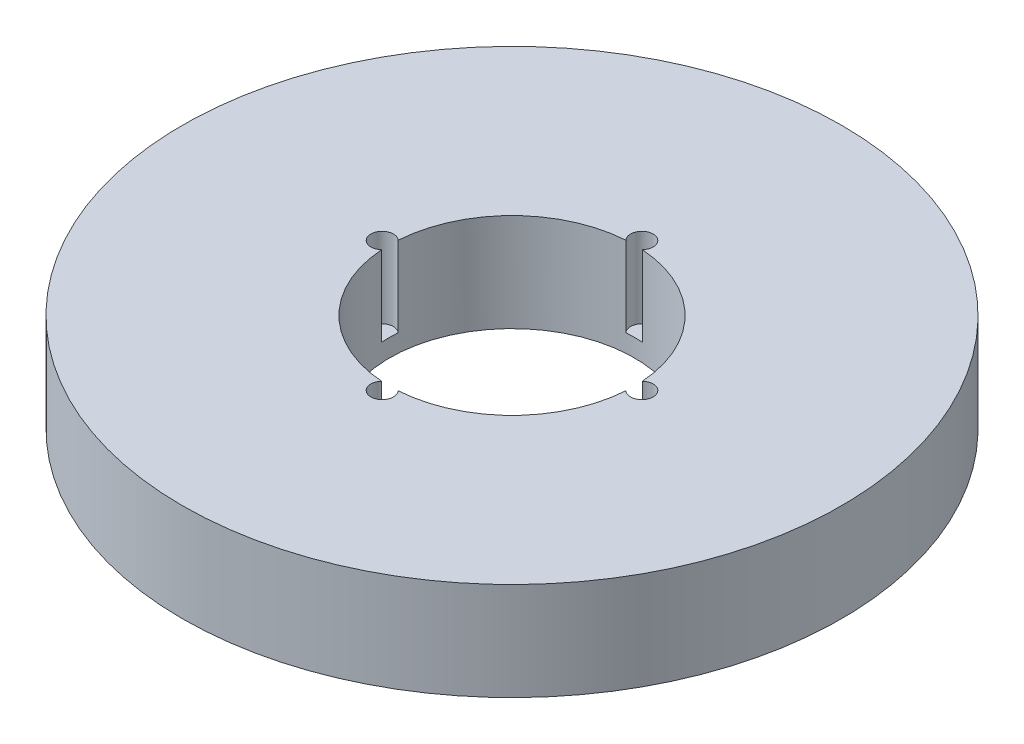
from build123d import *

# Parameters (mm, degrees)
SKETCH1_R           = 87.5
BOSS_EXTRUDE1_DEPTH = 26
SKETCH2_R           = 32.5
CUT_EXTRUDE1_DEPTH  = 127.445640494
SKETCH3_R           = 2.994766955
CUT_EXTRUDE2_DEPTH  = 21.282398415
CIRPATTERN1_COUNT   = 4


with BuildPart() as part:
    # Sketch1 → Boss-Extrude1 (new body)
    with BuildSketch(Plane(origin=(0, 0, 0), x_dir=(1, 0, 0), z_dir=(0, 1, 0))):
        Circle(SKETCH1_R)
    extrude(amount=BOSS_EXTRUDE1_DEPTH)

    # Sketch2 → Cut-Extrude1 (cut, through all)
    with BuildSketch(Plane(origin=(0, 0, 0), x_dir=(1, 0, 0), z_dir=(0, 1, 0))):
        Circle(SKETCH2_R)
    extrude(amount=CUT_EXTRUDE1_DEPTH, mode=Mode.SUBTRACT)

    # Sketch3 → Cut-Extrude2 (cut)
    with BuildSketch(Plane(origin=(0, 26, 0), x_dir=(1, 0, 0), z_dir=(0, 1, 0))):
        with Locations((-34.47707109, 0)):
            Circle(SKETCH3_R)
    cut_extrude2 = extrude(amount=-CUT_EXTRUDE2_DEPTH, mode=Mode.SUBTRACT)

    # CirPattern1: Cut-Extrude2 ×4 about axis
    cirpattern1_axis = Axis((0, 0, 0), (0, 1, 0))
    for i in range(1, CIRPATTERN1_COUNT):
        add(cut_extrude2.rotate(cirpattern1_axis, i * 360 / CIRPATTERN1_COUNT), mode=Mode.SUBTRACT)


solid = part.part
